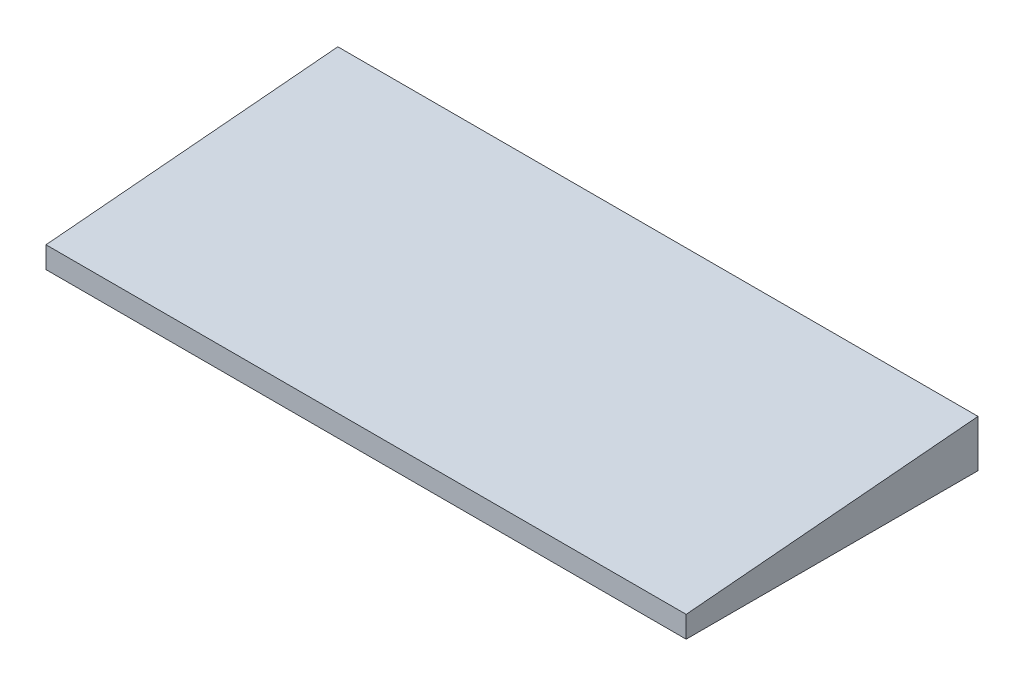
from build123d import *

# Parameters (mm, degrees)
SKETCH1_W               = 340
SKETCH1_H               = 155
BOSS_EXTRUDE1_DEPTH     = 25
CUT_EXTRUDE1_DEPTH      = 189.497347461
CUT_EXTRUDE1_DEPTH_BACK = 189.497347461


with BuildPart() as part:
    # Sketch1 → Boss-Extrude1 (new body)
    with BuildSketch(Plane(origin=(0, 0, 0), x_dir=(1, 0, 0), z_dir=(0, 1, 0))):
        Rectangle(SKETCH1_W, SKETCH1_H)
    extrude(amount=BOSS_EXTRUDE1_DEPTH)

    # Sketch2 → Cut-Extrude1 (cut, two sides: drawn at the far end of the back side and taken through both)
    with BuildSketch(Plane(origin=(0, 0, 0), x_dir=(0, 0, -1), z_dir=(1, 0, 0)).offset(-CUT_EXTRUDE1_DEPTH_BACK)):
        Polygon((-77.5, 11.439257153), (77.5, 25), (-77.5, 25), align=None)
    extrude(amount=CUT_EXTRUDE1_DEPTH + CUT_EXTRUDE1_DEPTH_BACK, mode=Mode.SUBTRACT)


solid = part.part
